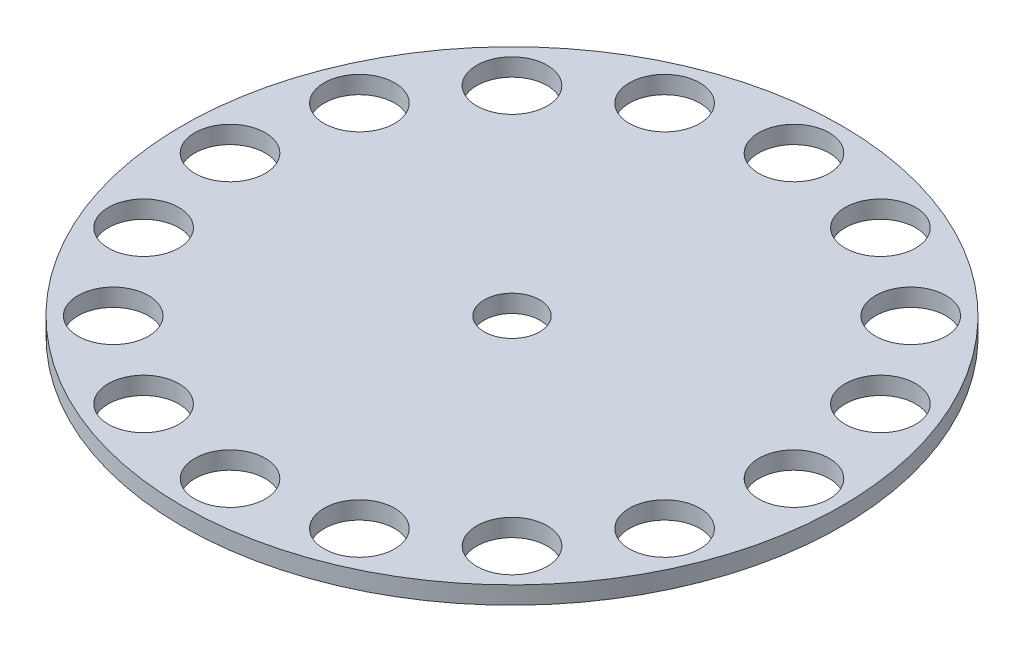
from build123d import *

# Parameters (mm, degrees)
SKETCH1_R           = 59.3725
SKETCH1_R_2         = 5
BOSS_EXTRUDE1_DEPTH = 3.175
SKETCH4_R           = 6.35
CUT_EXTRUDE1_DEPTH  = 85.02540174
CIRPATTERN3_COUNT   = 16


with BuildPart() as part:
    # Sketch1 → Boss-Extrude1 (new body)
    with BuildSketch(Plane(origin=(0, 0, 0), x_dir=(1, 0, 0), z_dir=(0, 1, 0))):
        Circle(SKETCH1_R)
        Circle(SKETCH1_R_2, mode=Mode.SUBTRACT)
    extrude(amount=BOSS_EXTRUDE1_DEPTH)

    # Sketch4 → Cut-Extrude1 (cut, through all)
    with BuildSketch(Plane(origin=(0, 3.175, 0), x_dir=(1, 0, 0), z_dir=(0, 1, 0))):
        with Locations((50.8, 0)):
            Circle(SKETCH4_R)
    cut_extrude1 = extrude(amount=-CUT_EXTRUDE1_DEPTH, mode=Mode.SUBTRACT)

    # CirPattern3: Cut-Extrude1 ×16 about axis
    cirpattern3_axis = Axis((0, 3.175, 0), (0, -1, 0))
    for i in range(1, CIRPATTERN3_COUNT):
        add(cut_extrude1.rotate(cirpattern3_axis, i * 360 / CIRPATTERN3_COUNT), mode=Mode.SUBTRACT)


solid = part.part
